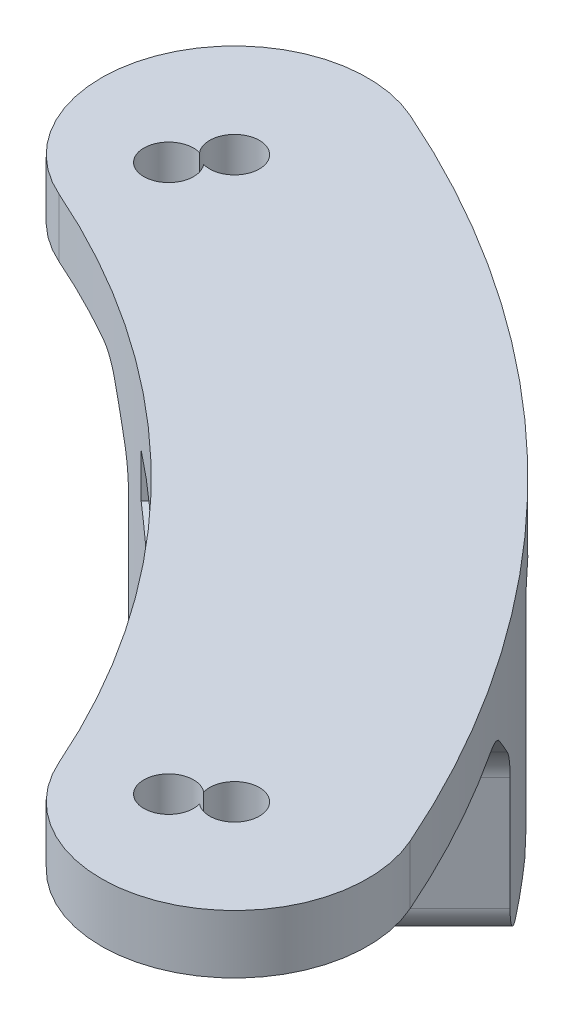
from build123d import *

# Parameters (mm, degrees)
BOSS_EXTRUDE1_DEPTH = 4
SKETCH2_W           = 8
SKETCH2_H           = 15
BOSS_EXTRUDE2_DEPTH = 30
CUT_EXTRUDE1_START  = -30
CUT_EXTRUDE1_DEPTH  = 30
SKETCH4_R           = 1.5
CUT_EXTRUDE2_DEPTH  = 145.949291803
FILLET1_R           = 2
CHAMFER1_SIZE       = 1
CHAMFER2_SIZE       = 4
FILLET2_R           = 3


with BuildPart() as part:
    # Sketch1 → Boss-Extrude1 (new body)
    with BuildSketch(Plane.XZ.offset(74.901515315)):
        with BuildLine():
            ThreePointArc((21.566916187, -71.495231174), (26.53319413, -76.858714128), (33.842822155, -76.844426529))
            ThreePointArc((33.842822155, -76.844426529), (59.373405242, -59.373405242), (76.844426529, -33.842822155))
            ThreePointArc((76.844426529, -33.842822155), (76.858714128, -26.53319413), (71.495231174, -21.566916187))
            ThreePointArc((71.495231174, -21.566916187), (64.870172632, -21.821666174), (60.172932274, -26.500579645))
            ThreePointArc((60.172932274, -26.500579645), (46.492270863, -46.492270863), (26.500579645, -60.172932274))
            ThreePointArc((26.500579645, -60.172932274), (21.821666174, -64.870172632), (21.566916187, -71.495231174))
        make_face()
        with BuildLine():
            ThreePointArc((28.854736371, -67.43368897), (27.014463113, -64.783999808), (30.075480266, -65.802642194))
            ThreePointArc((30.075480266, -65.802642194), (29.976860873, -66.373238505), (29.692444795, -66.877632626))
            ThreePointArc((29.692444795, -66.877632626), (31.190343286, -67.147662249), (31.8717009, -68.508679402))
            ThreePointArc((31.8717009, -68.508679402), (29.601104589, -70.110060009), (28.854736371, -67.43368897))
        make_face(mode=Mode.SUBTRACT)
        with BuildLine():
            ThreePointArc((66.877632626, -29.692444795), (64.266822586, -27.6466057), (67.502642194, -28.375480266))
            ThreePointArc((67.502642194, -28.375480266), (67.48531559, -28.617575785), (67.43368897, -28.854736371))
            ThreePointArc((67.43368897, -28.854736371), (69.237553968, -28.635881293), (70.208679402, -30.1717009))
            ThreePointArc((70.208679402, -30.1717009), (68.266583883, -31.854374297), (66.877632626, -29.692444795))
        make_face(mode=Mode.SUBTRACT)
    extrude(amount=BOSS_EXTRUDE1_DEPTH)

    # Sketch2 → Boss-Extrude2 (add)
    with BuildSketch(Plane(origin=(62.280244247, 0, -62.280244247), x_dir=(-0.7071067811865498, 0, -0.7071067811865452), z_dir=(0.7071067811865452, 0, -0.7071067811865498))):
        with Locations((-8, -86.401515315)):
            Rectangle(SKETCH2_W, SKETCH2_H)
        Polygon((4, -93.901515315), (12, -93.901515315), (12, -78.901515315), (8, -78.901515315), (8, -81.901515315), (4, -84.210916392), align=None)
    extrude(amount=-BOSS_EXTRUDE2_DEPTH)

    # Sketch3 → Cut-Extrude1 (cut)
    with BuildSketch(Plane.XZ.offset(93.901515315).offset(CUT_EXTRUDE1_START)):
        with BuildLine():
            Line((29.484052126, -58.768641044), (22.062889108, -51.347478026))
            Line((22.062889108, -51.347478026), (52.677923164, -23.025448826))
            Line((52.677923164, -23.025448826), (58.652501829, -29.714416185))
            ThreePointArc((58.652501829, -29.714416185), (46.400970155, -46.583392627), (29.484052126, -58.768641044))
        make_face()
        with BuildLine():
            Line((72.712363398, -41.991840982), (86.447631041, -52.417601978))
            Line((86.447631041, -52.417601978), (48.404595932, -83.58162252))
            Line((48.404595932, -83.58162252), (40.796709535, -73.389583669))
            ThreePointArc((40.796709535, -73.389583669), (58.885753549, -59.857084201), (72.712363398, -41.991840982))
        make_face()
    extrude(amount=CUT_EXTRUDE1_DEPTH, mode=Mode.SUBTRACT)

    # Sketch4 → Cut-Extrude2 (cut, through all)
    with BuildSketch(Plane(origin=(8.485281374, 0, 8.485281374), x_dir=(0.7071067811865454, 0, -0.7071067811865497), z_dir=(0.7071067811865497, 0, 0.7071067811865454))):
        with Locations((74.128214207, -88.901515315)):
            Circle(SKETCH4_R)
    extrude(amount=-CUT_EXTRUDE2_DEPTH, mode=Mode.SUBTRACT)

    # Fillet1
    fillet1_edges = [part.edges().sort_by_distance(p)[0] for p in [
        (43.752386609, -93.901515315, -60.722949357),
        (60.722949357, -93.901515315, -43.752386609),
    ]]
    fillet(fillet1_edges, radius=FILLET1_R)

    # Chamfer1
    chamfer1_edges = [part.edges().sort_by_distance(p)[0] for p in [
        (55.684503149, -93.901515315, -50.0276489),
        (50.0276489, -93.901515315, -55.684503149),
    ]]
    chamfer(chamfer1_edges, length=CHAMFER1_SIZE)

    # Chamfer2
    chamfer2_edges = [part.edges().sort_by_distance(p)[0] for p in [
        (43.752386609, -78.901515315, -60.722949357),
        (60.722949357, -78.901515315, -43.752386609),
    ]]
    chamfer(chamfer2_edges, length=CHAMFER2_SIZE)

    # Fillet2
    fillet2_edges = [part.edges().sort_by_distance(p)[0] for p in [
        (63.00381198, -78.901515315, -40.376394982),
        (60.722949357, -82.901515315, -43.752386609),
        (43.752386609, -82.901515315, -60.722949357),
        (40.376394982, -78.901515315, -63.00381198),
    ]]
    fillet(fillet2_edges, radius=FILLET2_R)


solid = part.part
